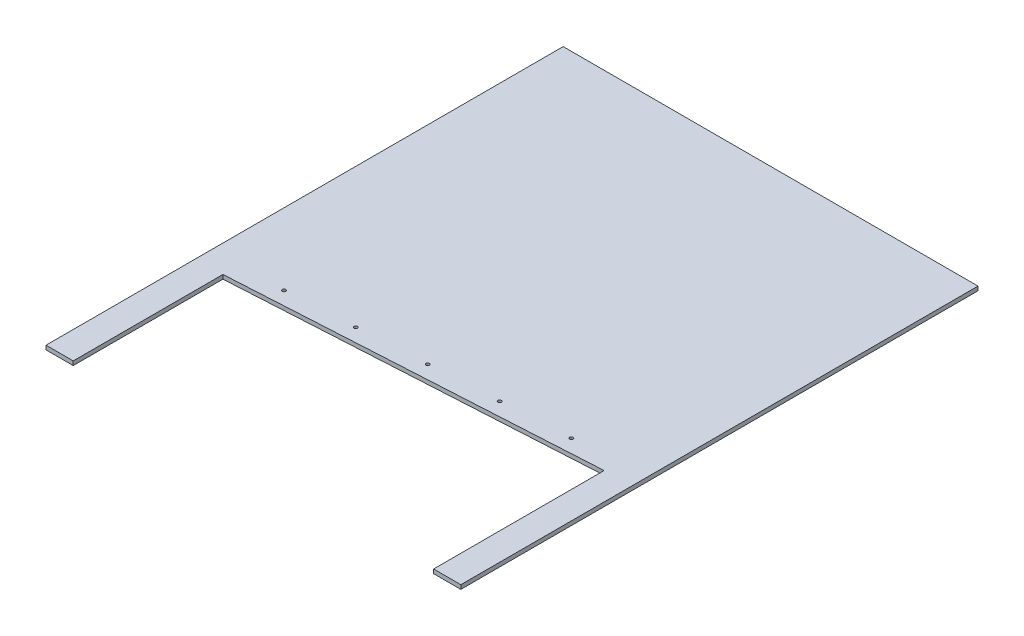
from build123d import *

# Parameters (mm, degrees)
BOSS_EXTRUDE1_DEPTH   = 3
M3_TAPPED_HOLE1_D     = 2.5
M3_TAPPED_HOLE1_DEPTH = 7.5
M3_TAPPED_HOLE1_TIP   = 0.751075774


with BuildPart() as part:
    # Sketch1 → Boss-Extrude1 (new body)
    with BuildSketch(Plane(origin=(0, 0, 0), x_dir=(1, 0, 0), z_dir=(0, 1, 0))):
        Polygon((-152.4, -135), (-152.4, -245), (-132.4, -245), (-132.4, -135), (132.4, -119.723076923), (132.4, -245), (152.4, -245), (152.4, -135), (152.4, 135), (-152.4, 135), align=None)
    extrude(amount=BOSS_EXTRUDE1_DEPTH)

    # M3 Tapped Hole1
    with Locations(Plane(origin=(0, 3, 0), x_dir=(1, 0, 0), z_dir=(0, 1, 0))):
        with Locations((0, -116.944245147), (-49.916997084, -119.824071902), (-99.833994168, -122.703898657), (49.916997084, -114.064418392), (99.833994168, -111.184591637)):
            Hole(M3_TAPPED_HOLE1_D / 2, depth=M3_TAPPED_HOLE1_DEPTH)
            with Locations((0, 0, -(M3_TAPPED_HOLE1_DEPTH + M3_TAPPED_HOLE1_TIP / 2))):  # 118° drill point
                Cone(0, M3_TAPPED_HOLE1_D / 2, M3_TAPPED_HOLE1_TIP, mode=Mode.SUBTRACT)


solid = part.part
